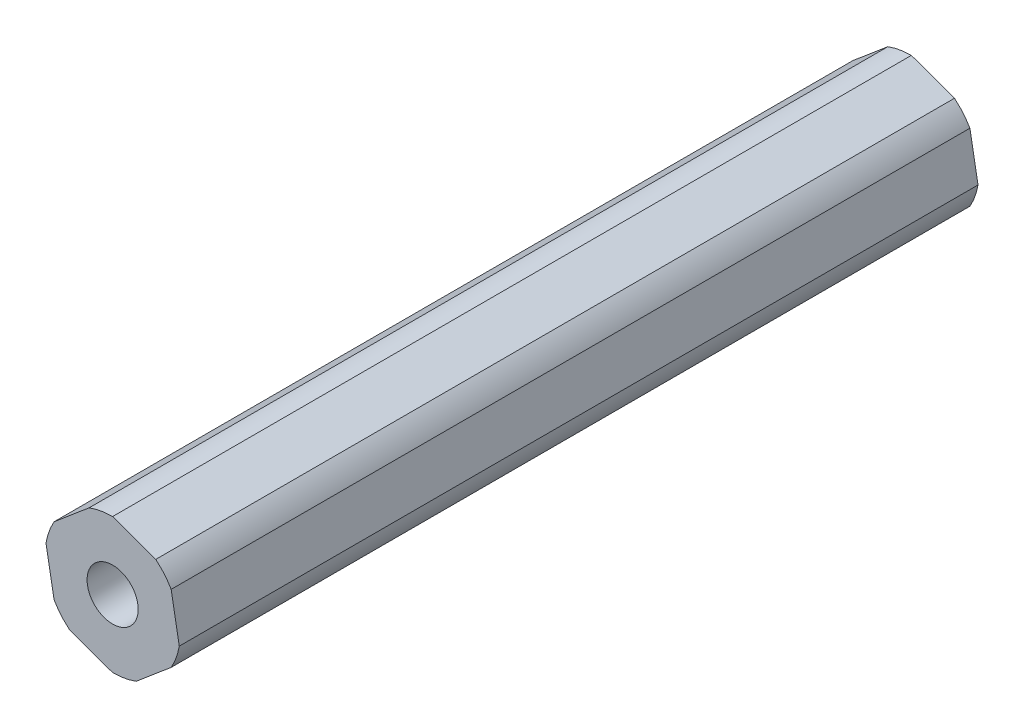
from build123d import *

# Parameters (mm, degrees)
BOSS_EXTRUDE1_DEPTH         = 79.756
SKETCH2_R                   = 2.0193
CUT_EXTRUDE1_DEPTH          = 81.317276782
F_1_4_20_TAPPED_HOLE1_D     = 5.1054
F_1_4_20_TAPPED_HOLE1_DEPTH = 19.05
F_1_4_20_TAPPED_HOLE1_TIP   = 1.533816902
F_1_4_20_TAPPED_HOLE2_D     = 5.1054
F_1_4_20_TAPPED_HOLE2_DEPTH = 19.05
F_1_4_20_TAPPED_HOLE2_TIP   = 1.533816902


with BuildPart() as part:
    # Sketch1 → Boss-Extrude1 (new body)
    with BuildSketch(Plane.XY):
        with BuildLine():
            Line((-6.654540832, 1.131188008), (-5.845671476, -3.375))
            ThreePointArc((-5.845671476, -3.375), (-5.15742276, -4.354709), (-4.306907968, -5.197407407))
            Line((-4.306907968, -5.197407407), (0, -6.75))
            ThreePointArc((0, -6.75), (1.19257724, -6.643813628), (2.347632865, -6.328595415))
            Line((2.347632865, -6.328595415), (5.845671476, -3.375))
            ThreePointArc((5.845671476, -3.375), (6.35, -2.289104628), (6.654540832, -1.131188008))
            Line((6.654540832, -1.131188008), (5.845671476, 3.375))
            ThreePointArc((5.845671476, 3.375), (5.15742276, 4.354709), (4.306907968, 5.197407407))
            Line((4.306907968, 5.197407407), (0, 6.75))
            ThreePointArc((0, 6.75), (-1.19257724, 6.643813628), (-2.347632865, 6.328595415))
            Line((-2.347632865, 6.328595415), (-5.845671476, 3.375))
            ThreePointArc((-5.845671476, 3.375), (-6.35, 2.289104628), (-6.654540832, 1.131188008))
        make_face()
    extrude(amount=BOSS_EXTRUDE1_DEPTH)

    # Sketch2 → Cut-Extrude1 (cut, through all)
    with BuildSketch(Plane.XY.offset(79.756)):
        Circle(SKETCH2_R)
    extrude(amount=-CUT_EXTRUDE1_DEPTH, mode=Mode.SUBTRACT)

    # 1/4-20 Tapped Hole1
    with Locations(Plane.XY.offset(79.756)):
        with Locations((0, 0)):
            Hole(F_1_4_20_TAPPED_HOLE1_D / 2, depth=F_1_4_20_TAPPED_HOLE1_DEPTH)
            with Locations((0, 0, -(F_1_4_20_TAPPED_HOLE1_DEPTH + F_1_4_20_TAPPED_HOLE1_TIP / 2))):  # 118° drill point
                Cone(0, F_1_4_20_TAPPED_HOLE1_D / 2, F_1_4_20_TAPPED_HOLE1_TIP, mode=Mode.SUBTRACT)

    # 1/4-20 Tapped Hole2
    with Locations(Plane(origin=(0, 0, 0), x_dir=(-1, 0, 0), z_dir=(0, 0, -1))):
        with Locations((0, 0)):
            Hole(F_1_4_20_TAPPED_HOLE2_D / 2, depth=F_1_4_20_TAPPED_HOLE2_DEPTH)
            with Locations((0, 0, -(F_1_4_20_TAPPED_HOLE2_DEPTH + F_1_4_20_TAPPED_HOLE2_TIP / 2))):  # 118° drill point
                Cone(0, F_1_4_20_TAPPED_HOLE2_D / 2, F_1_4_20_TAPPED_HOLE2_TIP, mode=Mode.SUBTRACT)


solid = part.part
